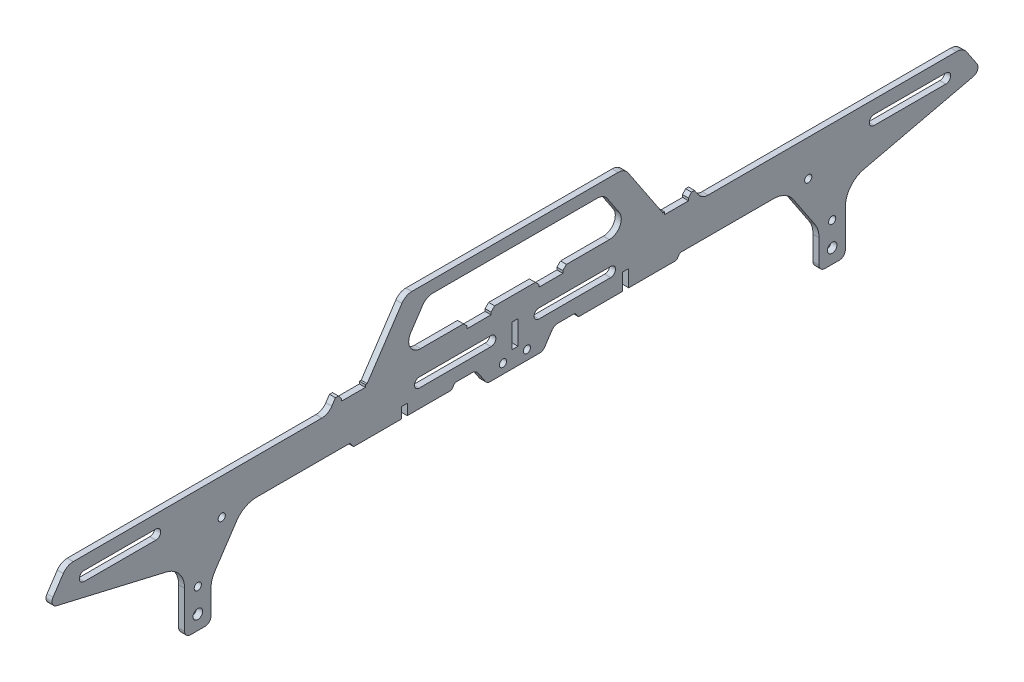
from build123d import *

# Parameters (mm, degrees)
SZKIC1_R                    = 3
SZKIC1_R_2                  = 4
SZKIC1_W                    = 5
SZKIC1_H                    = 20
DODANIE_WYCI_GNI_CIE1_DEPTH = 5


with BuildPart() as part:
    # Szkic1 → Dodanie-wyciągnięcie1 (new body)
    with BuildSketch(Plane(origin=(0, 0, 0), x_dir=(0, 0, -1), z_dir=(1, 0, 0))):
        with BuildLine():
            Line((141.628939909, -167.023096177), (162.28635445, -167.023096177))
            Line((162.28635445, -167.023096177), (182.943768991, -167.023096177))
            ThreePointArc((182.943768991, -167.023096177), (185.303058619, -166.43146917), (187.104020463, -164.796597158))
            Line((187.104020463, -164.796597158), (193.171821902, -155.694894999))
            ThreePointArc((193.171821902, -155.694894999), (195.332976115, -153.733048584), (198.164123668, -153.023096177))
            Line((198.164123668, -153.023096177), (211.47895275, -153.023096177))
            ThreePointArc((211.47895275, -153.023096177), (212.422668601, -153.259746979), (213.143053338, -153.913695784))
            Line((213.143053338, -153.913695784), (214.622253862, -156.132496569))
            ThreePointArc((214.622253862, -156.132496569), (215.342638599, -156.786445374), (216.28635445, -157.023096177))
            Line((216.28635445, -157.023096177), (252.28635445, -157.023096177))
            Line((252.28635445, -157.023096177), (252.28635445, -143.023096177))
            Line((252.28635445, -143.023096177), (257.28635445, -143.023096177))
            Line((257.28635445, -143.023096177), (257.28635445, -157.023096177))
            Line((257.28635445, -157.023096177), (296.28635445, -157.023096177))
            ThreePointArc((296.28635445, -157.023096177), (297.230070301, -156.786445374), (297.950455039, -156.132496569))
            Line((297.950455039, -156.132496569), (299.429655562, -153.913695784))
            ThreePointArc((299.429655562, -153.913695784), (300.1500403, -153.259746979), (301.093756151, -153.023096177))
            Line((301.093756151, -153.023096177), (378.249345947, -153.023096177))
            ThreePointArc((378.249345947, -153.023096177), (387.686504458, -155.389604201), (394.890351834, -161.929092252))
            Line((394.890351834, -161.929092252), (412.927360337, -188.984605007))
            ThreePointArc((412.927360337, -188.984605007), (415.42819498, -194.282925957), (416.28635445, -200.078608931))
            Line((416.28635445, -200.078608931), (416.28635445, -220.023096177))
            ThreePointArc((416.28635445, -220.023096177), (417.750820544, -223.558630083), (421.28635445, -225.023096177))
            Line((421.28635445, -225.023096177), (433.28635445, -225.023096177))
            ThreePointArc((433.28635445, -225.023096177), (436.821888356, -223.558630083), (438.28635445, -220.023096177))
            Line((438.28635445, -220.023096177), (438.28635445, -188.894175217))
            ThreePointArc((438.28635445, -188.894175217), (442.619837649, -176.461948895), (453.742379582, -169.417206962))
            Line((453.742379582, -169.417206962), (545.259797977, -148.06620183))
            ThreePointArc((545.259797977, -148.06620183), (548.773044368, -145.036678878), (548.284055731, -140.423458785))
            Line((548.284055731, -140.423458785), (539.652479351, -127.476094214))
            ThreePointArc((539.652479351, -127.476094214), (536.050555663, -124.206350189), (531.331976408, -123.023096177))
            Line((531.331976408, -123.023096177), (323.638192035, -123.023096177))
            ThreePointArc((323.638192035, -123.023096177), (318.91961278, -121.839842164), (315.317689092, -118.570098139))
            Line((315.317689092, -118.570098139), (312.28635445, -114.023096177))
            Line((312.28635445, -114.023096177), (309.78635445, -114.023096177))
            Line((309.78635445, -114.023096177), (307.28635445, -117.023096177))
            Line((307.28635445, -117.023096177), (307.28635445, -119.023096177))
            Line((307.28635445, -119.023096177), (287.28635445, -119.023096177))
            Line((287.28635445, -119.023096177), (287.28635445, -117.023096177))
            Line((287.28635445, -117.023096177), (285.80410345, -117.023096177))
            Line((285.80410345, -117.023096177), (256.772768808, -73.476094214))
            ThreePointArc((256.772768808, -73.476094214), (253.17084512, -70.206350189), (248.452265865, -69.023096177))
            Line((248.452265865, -69.023096177), (162.28635445, -69.023096177))
            Line((162.28635445, -69.023096177), (76.120443036, -69.023096177))
            ThreePointArc((76.120443036, -69.023096177), (71.40186378, -70.206350189), (67.799940092, -73.476094214))
            Line((67.799940092, -73.476094214), (38.768605451, -117.023096177))
            Line((38.768605451, -117.023096177), (37.28635445, -117.023096177))
            Line((37.28635445, -117.023096177), (37.28635445, -119.023096177))
            Line((37.28635445, -119.023096177), (17.28635445, -119.023096177))
            Line((17.28635445, -119.023096177), (17.28635445, -117.023096177))
            Line((17.28635445, -117.023096177), (14.78635445, -114.023096177))
            Line((14.78635445, -114.023096177), (12.28635445, -114.023096177))
            Line((12.28635445, -114.023096177), (9.255019809, -118.570098139))
            ThreePointArc((9.255019809, -118.570098139), (5.653096121, -121.839842164), (0.934516865, -123.023096177))
            Line((0.934516865, -123.023096177), (-206.759267507, -123.023096177))
            ThreePointArc((-206.759267507, -123.023096177), (-211.477846763, -124.206350189), (-215.079770451, -127.476094214))
            Line((-215.079770451, -127.476094214), (-223.711346831, -140.423458785))
            ThreePointArc((-223.711346831, -140.423458785), (-224.200335468, -145.036678878), (-220.687089076, -148.06620183))
            Line((-220.687089076, -148.06620183), (-129.169670682, -169.417206962))
            ThreePointArc((-129.169670682, -169.417206962), (-118.047128749, -176.461948895), (-113.71364555, -188.894175217))
            Line((-113.71364555, -188.894175217), (-113.71364555, -220.023096177))
            ThreePointArc((-113.71364555, -220.023096177), (-112.249179456, -223.558630083), (-108.71364555, -225.023096177))
            Line((-108.71364555, -225.023096177), (-96.71364555, -225.023096177))
            ThreePointArc((-96.71364555, -225.023096177), (-93.178111644, -223.558630083), (-91.71364555, -220.023096177))
            Line((-91.71364555, -220.023096177), (-91.71364555, -200.078608931))
            ThreePointArc((-91.71364555, -200.078608931), (-90.85548608, -194.282925957), (-88.354651437, -188.984605007))
            Line((-88.354651437, -188.984605007), (-70.317642933, -161.929092252))
            ThreePointArc((-70.317642933, -161.929092252), (-63.113795557, -155.389604201), (-53.676637047, -153.023096177))
            Line((-53.676637047, -153.023096177), (23.47895275, -153.023096177))
            ThreePointArc((23.47895275, -153.023096177), (24.422668601, -153.259746979), (25.143053338, -153.913695784))
            Line((25.143053338, -153.913695784), (26.622253862, -156.132496569))
            ThreePointArc((26.622253862, -156.132496569), (27.342638599, -156.786445374), (28.28635445, -157.023096177))
            Line((28.28635445, -157.023096177), (67.28635445, -157.023096177))
            Line((67.28635445, -157.023096177), (67.28635445, -148.023096177))
            Line((67.28635445, -148.023096177), (72.28635445, -148.023096177))
            Line((72.28635445, -148.023096177), (72.28635445, -157.023096177))
            Line((72.28635445, -157.023096177), (108.28635445, -157.023096177))
            ThreePointArc((108.28635445, -157.023096177), (109.230070301, -156.786445374), (109.950455039, -156.132496569))
            Line((109.950455039, -156.132496569), (111.429655562, -153.913695784))
            ThreePointArc((111.429655562, -153.913695784), (112.1500403, -153.259746979), (113.093756151, -153.023096177))
            Line((113.093756151, -153.023096177), (126.408585233, -153.023096177))
            ThreePointArc((126.408585233, -153.023096177), (129.239732786, -153.733048584), (131.400886999, -155.694894999))
            Line((131.400886999, -155.694894999), (137.468688438, -164.796597158))
            ThreePointArc((137.468688438, -164.796597158), (139.269650282, -166.43146917), (141.628939909, -167.023096177))
        make_face()
        with Locations((152.28635445, -159.023096177)):
            Circle(SZKIC1_R, mode=Mode.SUBTRACT)
        with Locations((-82.71364555, -153.023096177)):
            Circle(SZKIC1_R, mode=Mode.SUBTRACT)
        with Locations((407.28635445, -153.023096177)):
            Circle(SZKIC1_R, mode=Mode.SUBTRACT)
        with Locations((172.28635445, -159.023096177)):
            Circle(SZKIC1_R, mode=Mode.SUBTRACT)
        with Locations((427.28635445, -193.023096177)):
            Circle(SZKIC1_R, mode=Mode.SUBTRACT)
        with Locations((427.28635445, -213.023096177)):
            Circle(SZKIC1_R_2, mode=Mode.SUBTRACT)
        with Locations((-102.71364555, -213.023096177)):
            Circle(SZKIC1_R_2, mode=Mode.SUBTRACT)
        with Locations((-102.71364555, -193.023096177)):
            Circle(SZKIC1_R, mode=Mode.SUBTRACT)
        with BuildLine():
            Line((-197.71364555, -134.023096177), (-137.71364555, -134.023096177))
            ThreePointArc((-137.71364555, -134.023096177), (-133.71364555, -138.023096177), (-137.71364555, -142.023096177))
            Line((-137.71364555, -142.023096177), (-197.71364555, -142.023096177))
            ThreePointArc((-197.71364555, -142.023096177), (-201.71364555, -138.023096177), (-197.71364555, -134.023096177))
        make_face(mode=Mode.SUBTRACT)
        with BuildLine():
            Line((82.28635445, -134.023096177), (142.28635445, -134.023096177))
            ThreePointArc((142.28635445, -134.023096177), (146.28635445, -138.023096177), (142.28635445, -142.023096177))
            Line((142.28635445, -142.023096177), (82.28635445, -142.023096177))
            ThreePointArc((82.28635445, -142.023096177), (78.28635445, -138.023096177), (82.28635445, -134.023096177))
        make_face(mode=Mode.SUBTRACT)
        with BuildLine():
            Line((242.28635445, -134.023096177), (182.28635445, -134.023096177))
            ThreePointArc((182.28635445, -134.023096177), (178.28635445, -138.023096177), (182.28635445, -142.023096177))
            Line((182.28635445, -142.023096177), (242.28635445, -142.023096177))
            ThreePointArc((242.28635445, -142.023096177), (246.28635445, -138.023096177), (242.28635445, -134.023096177))
        make_face(mode=Mode.SUBTRACT)
        with BuildLine():
            Line((522.28635445, -142.023096177), (462.28635445, -142.023096177))
            ThreePointArc((462.28635445, -142.023096177), (458.28635445, -138.023096177), (462.28635445, -134.023096177))
            Line((462.28635445, -134.023096177), (522.28635445, -134.023096177))
            ThreePointArc((522.28635445, -134.023096177), (526.28635445, -138.023096177), (522.28635445, -142.023096177))
        make_face(mode=Mode.SUBTRACT)
        with BuildLine():
            Line((162.28635445, -114.023096177), (179.28635445, -114.023096177))
            Line((179.28635445, -114.023096177), (182.28635445, -117.023096177))
            Line((182.28635445, -117.023096177), (182.28635445, -119.023096177))
            Line((182.28635445, -119.023096177), (202.28635445, -119.023096177))
            Line((202.28635445, -119.023096177), (202.28635445, -117.023096177))
            Line((202.28635445, -117.023096177), (205.28635445, -114.023096177))
            Line((205.28635445, -114.023096177), (241.081924028, -114.023096177))
            ThreePointArc((241.081924028, -114.023096177), (249.898670016, -108.741675432), (249.402426972, -98.476094214))
            Line((249.402426972, -98.476094214), (239.402426972, -83.476094214))
            ThreePointArc((239.402426972, -83.476094214), (235.800503284, -80.206350189), (231.081924028, -79.023096177))
            Line((231.081924028, -79.023096177), (162.28635445, -79.023096177))
            Line((162.28635445, -79.023096177), (93.490784872, -79.023096177))
            ThreePointArc((93.490784872, -79.023096177), (88.772205617, -80.206350189), (85.170281929, -83.476094214))
            Line((85.170281929, -83.476094214), (75.170281929, -98.476094214))
            ThreePointArc((75.170281929, -98.476094214), (74.674038884, -108.741675432), (83.490784872, -114.023096177))
            Line((83.490784872, -114.023096177), (119.28635445, -114.023096177))
            Line((119.28635445, -114.023096177), (122.28635445, -117.023096177))
            Line((122.28635445, -117.023096177), (122.28635445, -119.023096177))
            Line((122.28635445, -119.023096177), (142.28635445, -119.023096177))
            Line((142.28635445, -119.023096177), (142.28635445, -117.023096177))
            Line((142.28635445, -117.023096177), (145.28635445, -114.023096177))
            Line((145.28635445, -114.023096177), (162.28635445, -114.023096177))
        make_face(mode=Mode.SUBTRACT)
        with Locations((162.28635445, -143.023096177)):
            Rectangle(SZKIC1_W, SZKIC1_H, mode=Mode.SUBTRACT)
    extrude(amount=DODANIE_WYCI_GNI_CIE1_DEPTH)


solid = part.part
